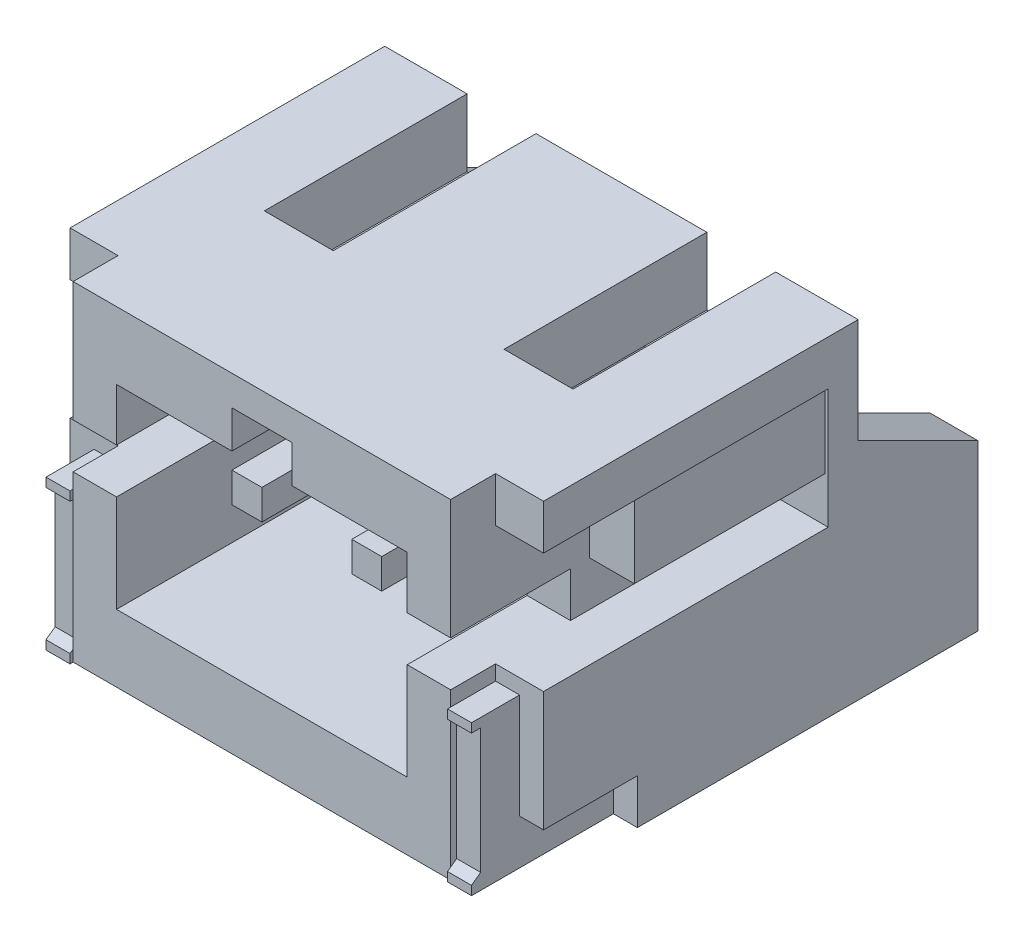
from build123d import *

# Parameters (mm, degrees)
SKETCH1_W           = 7.9
SKETCH1_H           = 6
BOSS_EXTRUDE1_DEPTH = 5.5
CUT_EXTRUDE1_DEPTH  = 4.95
SKETCH3_W           = 5.5
SKETCH3_H           = 2
CUT_EXTRUDE2_DEPTH  = 0.05
CUT_EXTRUDE3_DEPTH  = 0.8
SKETCH5_W           = 1.15
SKETCH5_H           = 3.383478064
CUT_EXTRUDE4_DEPTH  = 1.125
BOSS_EXTRUDE2_DEPTH = 0.8
SKETCH7_W           = 2
SKETCH7_H           = 0.75
CUT_EXTRUDE5_DEPTH  = 5.575
BOSS_EXTRUDE4_DEPTH = 0.4
BASE_FLANGE1_DEPTH  = 0.25
BOSS_EXTRUDE5_DEPTH = 0.4
FILLET1_R           = 0.25


# Sheet-metal steps are written as plain solids
with BuildPart() as part:
    # Sketch1 → Boss-Extrude1 (new body)
    with BuildSketch(Plane(origin=(0, 0, 0), x_dir=(1, 0, 0), z_dir=(0, 1, 0))):
        Rectangle(SKETCH1_W, SKETCH1_H)
    extrude(amount=BOSS_EXTRUDE1_DEPTH)

    # Sketch2 → Cut-Extrude1 (cut)
    with BuildSketch(Plane.XY.offset(3)):
        Polygon((-2.425, 4.375), (-0.5, 4.375), (-0.5, 5), (0.5, 5), (0.5, 4.375), (2.425, 4.375), (2.425, 1.125), (-2.425, 1.125), align=None)
    extrude(amount=-CUT_EXTRUDE1_DEPTH, mode=Mode.SUBTRACT)

    # Sketch3 → Cut-Extrude2 (cut)
    with BuildSketch(Plane(origin=(3.95, 0, 0), x_dir=(0, 0, -1), z_dir=(1, 0, 0))):
        with Locations((-0.25, 3.75)):
            Rectangle(SKETCH3_W, SKETCH3_H)
    cut_extrude2 = extrude(amount=-CUT_EXTRUDE2_DEPTH, mode=Mode.SUBTRACT)

    # Mirror1: Cut-Extrude2 across plane
    add(cut_extrude2.mirror(Plane(origin=(0, 0, 0), x_dir=(0, 0, 1), z_dir=(1, 0, 0))), mode=Mode.SUBTRACT)

    # Sketch4 → Cut-Extrude3 (cut)
    with BuildSketch(Plane(origin=(3.95, 0, 0), x_dir=(0, 0, -1), z_dir=(1, 0, 0))):
        Polygon((-2.25, 5.5), (-2.25, 4.75), (-0.684226185, 4.75), (-0.684226185, 3.5), (2.5, 3.5), (2.5, 2.75), (-2.25, 2.75), (-2.25, 0.75), (-0.684226185, 0.75), (-0.684226185, 0), (-3, 0), (-3, 5.5), align=None)
    cut_extrude3 = extrude(amount=-CUT_EXTRUDE3_DEPTH, mode=Mode.SUBTRACT)

    # Mirror2: Cut-Extrude3 across plane
    add(cut_extrude3.mirror(Plane(origin=(0, 0, 0), x_dir=(0, 0, 1), z_dir=(1, 0, 0))), mode=Mode.SUBTRACT)

    # Sketch5 → Cut-Extrude4 (cut)
    with BuildSketch(Plane(origin=(0, 5.5, 0), x_dir=(1, 0, 0), z_dir=(0, 1, 0))):
        with Locations((-2, 1.308260968)):
            Rectangle(SKETCH5_W, SKETCH5_H)
        with Locations((2, 1.308260968)):
            Rectangle(SKETCH5_W, SKETCH5_H)
    extrude(amount=-CUT_EXTRUDE4_DEPTH, mode=Mode.SUBTRACT)

    # Sketch6 → Boss-Extrude2 (add)
    with BuildSketch(Plane(origin=(3.95, 0, 0), x_dir=(0, 0, -1), z_dir=(1, 0, 0))):
        Polygon((3, 3.75), (5, 2.75), (5, 0), (3, 0), align=None)
    boss_extrude2 = extrude(amount=-BOSS_EXTRUDE2_DEPTH)

    # Mirror3: Boss-Extrude2 across plane
    add(boss_extrude2.mirror(Plane(origin=(0, 0, 0), x_dir=(0, 0, 1), z_dir=(1, 0, 0))))

    # Sketch7 → Cut-Extrude5 (cut)
    with BuildSketch(Plane(origin=(3.15, 0, 0), x_dir=(0, 0, -1), z_dir=(1, 0, 0))):
        with Locations((-2, 3.125)):
            Rectangle(SKETCH7_W, SKETCH7_H)
    cut_extrude5 = extrude(amount=-CUT_EXTRUDE5_DEPTH, mode=Mode.SUBTRACT)

    # Mirror4: Cut-Extrude5 across plane
    add(cut_extrude5.mirror(Plane(origin=(0, 0, 0), x_dir=(0, 0, 1), z_dir=(1, 0, 0))), mode=Mode.SUBTRACT)


with BuildPart() as body_2:
    # Sketch8 → Boss-Extrude4 (new body)
    with BuildSketch(Plane(origin=(3.15, 0, 0), x_dir=(0, 0, -1), z_dir=(1, 0, 0))):
        Polygon((-2.25, 2.5), (-3.05240723, 2.5), (-3.05240723, 2.35), (-2.899443331, 2.35), (-2.899443331, 0.260631692), (-3.05240723, 0.15), (-3.05240723, 0), (-0.684226185, 0), (-0.684226185, 0.75), (-2.25, 0.75), align=None)
    extrude(amount=BOSS_EXTRUDE4_DEPTH)


with BuildPart() as body_3:
    # Sketch9 → Base-Flange1 (new, symmetric)
    with BuildSketch(Plane(origin=(1, 0, 0), x_dir=(0, 0, -1), z_dir=(1, 0, 0))):
        with BuildLine():
            Line((-2.25, 2.85), (2.95, 2.85))
            ThreePointArc((2.95, 2.85), (2.985355339, 2.835355339), (3, 2.8))
            Line((3, 2.8), (3, 0.55))
            ThreePointArc((3, 0.55), (3.16109127, 0.16109127), (3.55, 0))
            Line((3.55, 0), (5.6, 0))
            Line((5.6, 0), (5.6, 0.5))
            Line((5.6, 0.5), (3.55, 0.5))
            ThreePointArc((3.55, 0.5), (3.514644661, 0.514644661), (3.5, 0.55))
            Line((3.5, 0.55), (3.5, 2.8))
            ThreePointArc((3.5, 2.8), (3.33890873, 3.18890873), (2.95, 3.35))
            Line((2.95, 3.35), (-2.25, 3.35))
            Line((-2.25, 3.35), (-2.25, 2.85))
        make_face()
    extrude(amount=BASE_FLANGE1_DEPTH, both=True)

    # Fillet1
    fillet1_edges = [body_3.edges().sort_by_distance(p)[0] for p in [
        (1, 0, -5.6),
        (1, 0.5, -5.6),
    ]]
    fillet(fillet1_edges, radius=FILLET1_R - 0.0001)  # a hair under: the kernel refuses the full size


with BuildPart() as body_4:
    # Sketch14 → Boss-Extrude5 (new body)
    with BuildSketch(Plane(origin=(-3.15, 0, -3.15), x_dir=(0, 0, -1), z_dir=(1, 0, 0))):
        Polygon((-5.4, 2.5), (-6.20240723, 2.5), (-6.20240723, 2.35), (-6.049443331, 2.35), (-6.049443331, 0.260631692), (-6.20240723, 0.15), (-6.20240723, 0), (-3.834226185, 0), (-3.834226185, 0.75), (-5.4, 0.75), align=None)
    extrude(amount=-BOSS_EXTRUDE5_DEPTH)


with BuildPart() as body_5:
    # Mirror7: mirrored copy
    add(body_3.part.mirror(Plane(origin=(0, 0, 0), x_dir=(0, 0, 1), z_dir=(1, 0, 0))))


solid = Compound([part.part, body_2.part, body_3.part, body_4.part, body_5.part])
